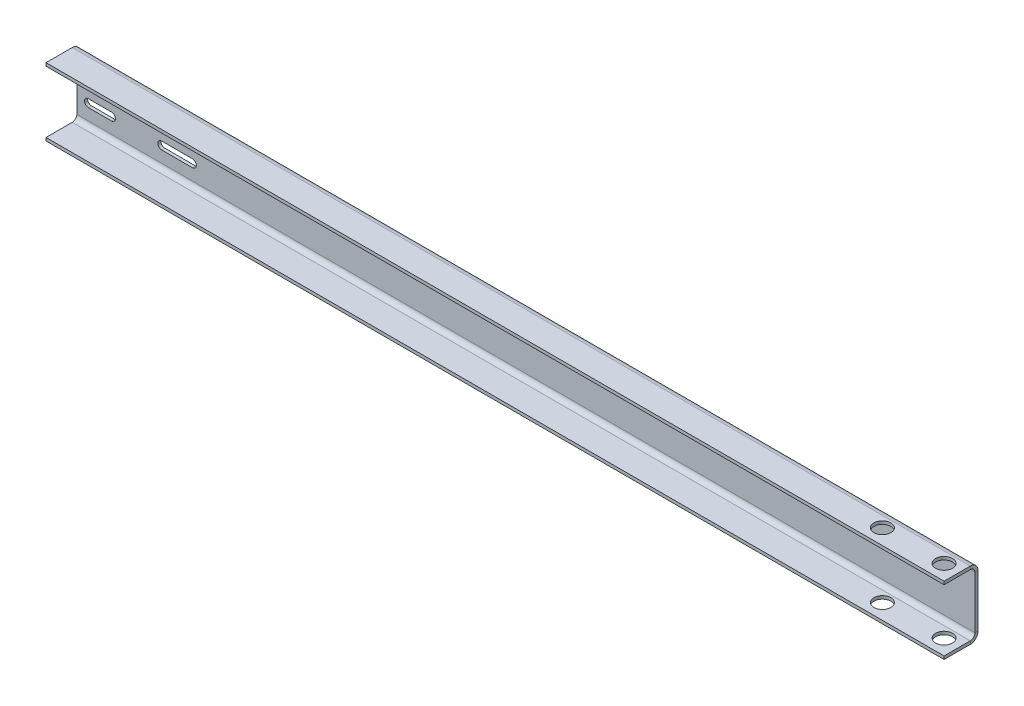
from build123d import *

# Parameters (mm, degrees)
SKETCH1_W                    = 1165
SKETCH1_H                    = 88
BASE_FLANGE1_DEPTH           = 4
EDGE_FLANGE1_STRIP_W         = 28
EDGE_FLANGE1_STRIP_H         = 4
EDGE_FLANGE1_STRIP_CUT_DEPTH = 1165
EDGE_FLANGE1_DEPTH           = 1165
EDGE_FLANGE2_STRIP_W         = 28
EDGE_FLANGE2_STRIP_H         = 4
EDGE_FLANGE2_STRIP_CUT_DEPTH = 1165
EDGE_FLANGE2_DEPTH           = 1165
CUT_EXTRUDE1_DEPTH           = 871.900176512
CUT_EXTRUDE1_DEPTH_BACK      = 871.900176512
SKETCH12_R                   = 11
CUT_EXTRUDE2_DEPTH           = 872.093059006


# Sheet-metal steps are written as plain solids
with BuildPart() as part:
    # Sketch1 → Base-Flange1 (new body)
    with BuildSketch(Plane.XY):
        with Locations((-283.018987342, 44)):
            Rectangle(SKETCH1_W, SKETCH1_H)
    extrude(amount=-BASE_FLANGE1_DEPTH)

    # Edge-Flange1 strip (across the edge) → Edge-Flange1 strip cut (cut)
    with BuildSketch(Plane(origin=(299.481012658, 88, 0), x_dir=(0, -1, 0), z_dir=(-1, 0, 0))):
        with Locations((-4, -2)):
            Rectangle(EDGE_FLANGE1_STRIP_W, EDGE_FLANGE1_STRIP_H)
    extrude(amount=EDGE_FLANGE1_STRIP_CUT_DEPTH, mode=Mode.SUBTRACT)

    # Edge-Flange1 section (across the edge) → Edge-Flange1 (add)
    with BuildSketch(Plane(origin=(299.481012658, 88, 0), x_dir=(0, -1, 0), z_dir=(-1, 0, 0))):
        with BuildLine():
            Line((0, 6), (0, 40))
            Line((0, 40), (4, 40))
            Line((4, 40), (4, 6))
            ThreePointArc((4, 6), (5.757359313, 1.757359313), (10, 0))
            Line((10, 0), (10, -4))
            ThreePointArc((10, -4), (2.928932188, -1.071067812), (0, 6))
        make_face()
    extrude(amount=EDGE_FLANGE1_DEPTH)

    # Edge-Flange2 strip (across the edge) → Edge-Flange2 strip cut (cut)
    with BuildSketch(Plane.YZ.offset(-865.518987342)):
        with Locations((-4, -2)):
            Rectangle(EDGE_FLANGE2_STRIP_W, EDGE_FLANGE2_STRIP_H)
    extrude(amount=EDGE_FLANGE2_STRIP_CUT_DEPTH, mode=Mode.SUBTRACT)

    # Edge-Flange2 section (across the edge) → Edge-Flange2 (add)
    with BuildSketch(Plane.YZ.offset(-865.518987342)):
        with BuildLine():
            Line((0, 6), (0, 40))
            Line((0, 40), (4, 40))
            Line((4, 40), (4, 6))
            ThreePointArc((4, 6), (5.757359313, 1.757359313), (10, 0))
            Line((10, 0), (10, -4))
            ThreePointArc((10, -4), (2.928932188, -1.071067812), (0, 6))
        make_face()
    extrude(amount=EDGE_FLANGE2_DEPTH)

    # Sketch12 → Cut-Extrude1 (cut, two sides: drawn at the far end of the back side and taken through both)
    with BuildSketch(Plane.XZ.offset(-CUT_EXTRUDE1_DEPTH_BACK)):
        with Locations(Location((279.481012658, 20, 0), (0, 0, 270))):
            Circle(SKETCH12_R)
        with Locations(Location((199.481012658, 20, 0), (0, 0, 270))):
            Circle(SKETCH12_R)
    extrude(amount=CUT_EXTRUDE1_DEPTH + CUT_EXTRUDE1_DEPTH_BACK, mode=Mode.SUBTRACT)

    # Sketch13 → Cut-Extrude2 (cut, through all)
    with BuildSketch(Plane(origin=(0, 0, -4), x_dir=(-1, 0, 0), z_dir=(0, 0, -1))):
        with BuildLine():
            Line((850.518987342, 25), (820.518987342, 25))
            ThreePointArc((820.518987342, 25), (815.518987342, 30), (820.518987342, 35))
            Line((820.518987342, 35), (850.518987342, 35))
            ThreePointArc((850.518987342, 35), (855.518987342, 30), (850.518987342, 25))
        make_face()
        with BuildLine():
            Line((755.518987342, 25), (715.518987342, 25))
            ThreePointArc((715.518987342, 25), (710.518987342, 30), (715.518987342, 35))
            Line((715.518987342, 35), (755.518987342, 35))
            ThreePointArc((755.518987342, 35), (760.518987342, 30), (755.518987342, 25))
        make_face()
    extrude(amount=-CUT_EXTRUDE2_DEPTH, mode=Mode.SUBTRACT)


solid = part.part
